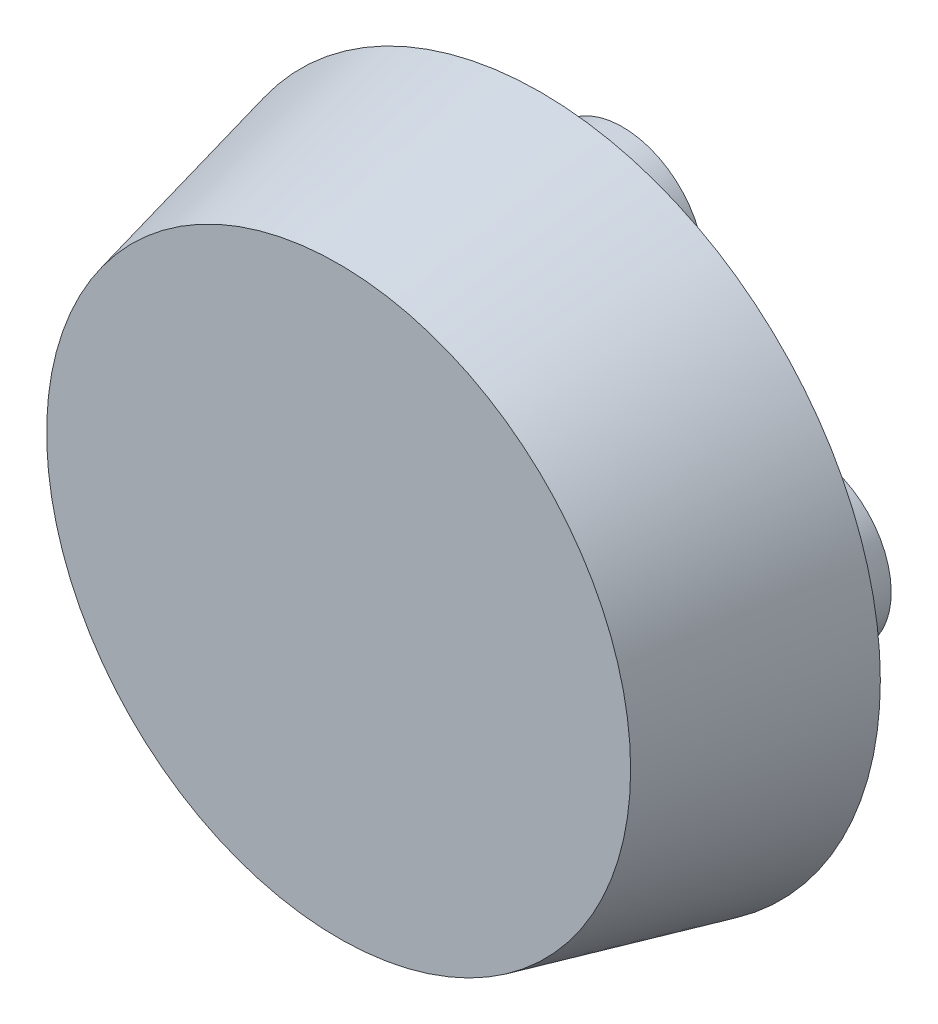
from build123d import *

# Parameters (mm, degrees)
CABLE_SKETCH_R      = 35
CABLE_EXTRUDE_DEPTH = 35
CABLE_PATTERN_COUNT = 4


with BuildPart() as part:
    # Big Plug Sketch → Big Plug (revolve)
    with BuildSketch(Plane(origin=(0, 0, 0), x_dir=(0, 0, -1), z_dir=(1, 0, 0))):
        with BuildLine():
            Line((531.601551916, 125), (531.601551916, 0))
            Line((531.601551916, 0), (635, 0))
            ThreePointArc((635, 0), (630.771254316, 73.161634266), (618.141339438, 145.348837209))
            Line((618.141339438, 145.348837209), (531.601551916, 125))
        make_face()
    revolve(axis=Axis((0, 0, 0), (0, 0, -1)))

    # Cable Sketch → Cable Extrude (add)
    with BuildSketch(Plane.XY.offset(-618.141339438)):
        with Locations((0, 80)):
            Circle(CABLE_SKETCH_R)
    cable_extrude = extrude(amount=-CABLE_EXTRUDE_DEPTH)

    # Cable Pattern: Cable Extrude ×4 about axis
    cable_pattern_axis = Axis((0, 0, -531.601551916), (0, 0, -1))
    for i in range(1, CABLE_PATTERN_COUNT):
        add(cable_extrude.rotate(cable_pattern_axis, i * 360 / CABLE_PATTERN_COUNT))


solid = part.part
